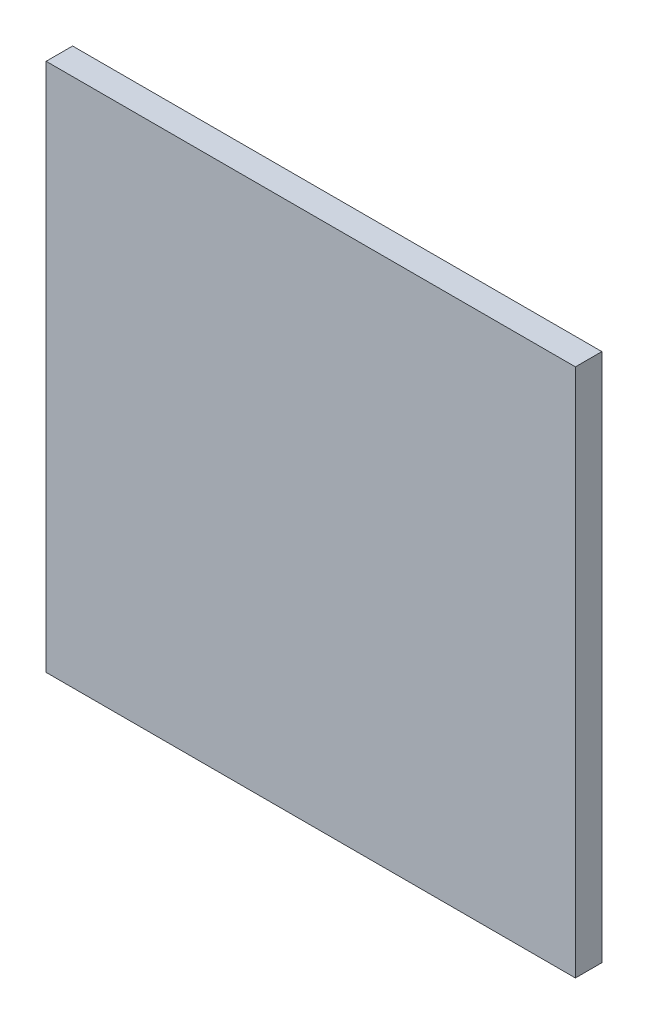
from build123d import *

# Parameters (mm, degrees)
SKIZZE1_W                       = 20
SKIZZE1_H                       = 20
AUFSATZ_LINEAR_AUSTRAGEN1_DEPTH = 1


with BuildPart() as part:
    # Skizze1 → Aufsatz-Linear austragen1 (new body)
    with BuildSketch(Plane.XY):
        with Locations((-2.517837541, -1.875)):
            Rectangle(SKIZZE1_W, SKIZZE1_H)
    extrude(amount=AUFSATZ_LINEAR_AUSTRAGEN1_DEPTH)


solid = part.part
